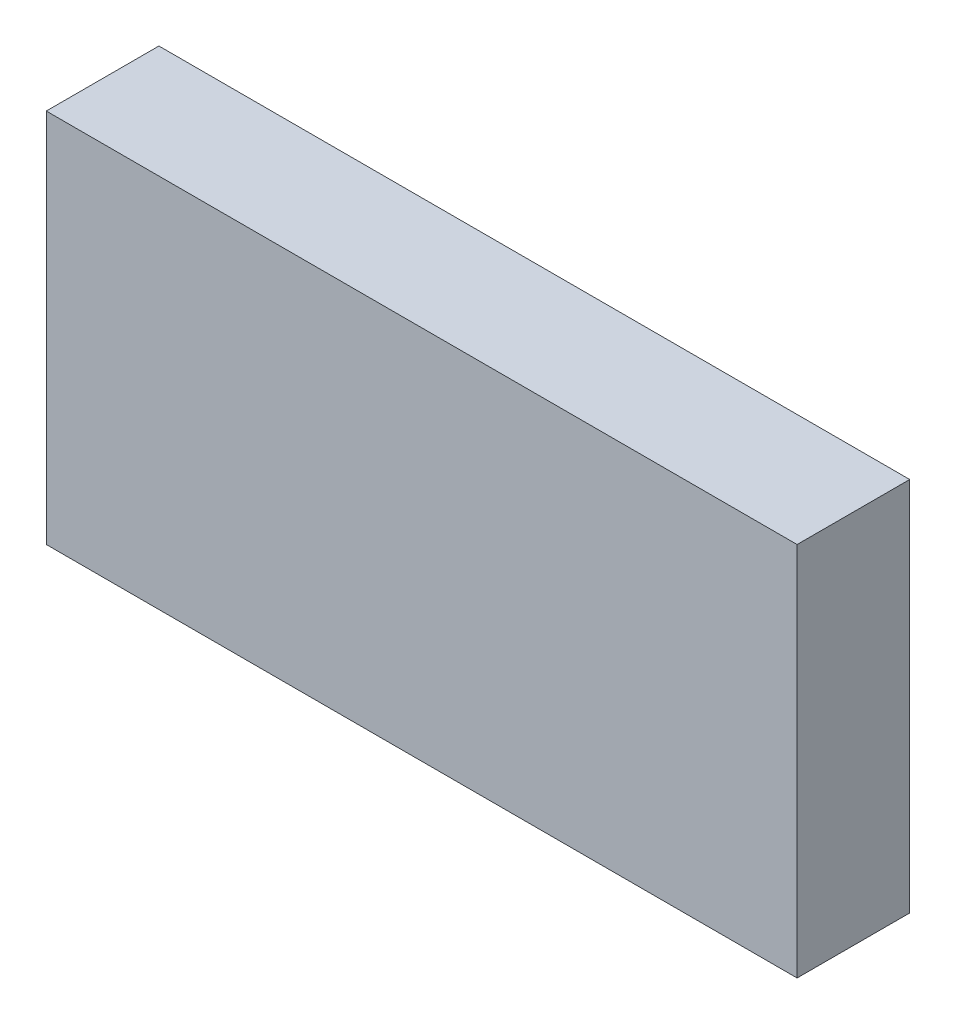
from build123d import *

# Parameters (mm, degrees)
SKETCH1_W           = 2
SKETCH1_H           = 1
BOSS_EXTRUDE1_DEPTH = 0.3


with BuildPart() as part:
    # Sketch1 → Boss-Extrude1 (new body)
    with BuildSketch(Plane.XY):
        Rectangle(SKETCH1_W, SKETCH1_H)
    extrude(amount=BOSS_EXTRUDE1_DEPTH)


solid = part.part
